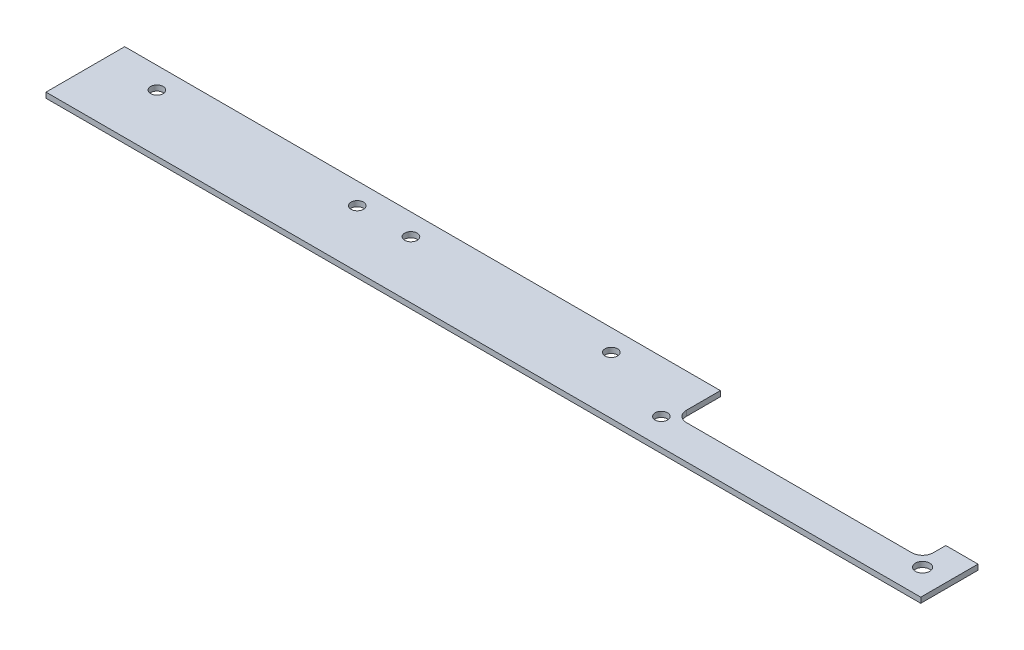
from build123d import *

# Parameters (mm, degrees)
SKETCH_1_R      = 1.75
SKETCH_1_R_2    = 2
EXTRUDE_1_DEPTH = 1.5


with BuildPart() as part:
    # Эскиз1 → Бобышка-Вытянуть1 (new body)
    with BuildSketch(Plane(origin=(0, 0, 0), x_dir=(1, 0, 0), z_dir=(0, 1, 0))):
        with BuildLine():
            Line((166.5, 22), (166.5, 12.5))
            ThreePointArc((166.5, 12.5), (167.378679656, 10.378679656), (169.5, 9.5))
            Line((169.5, 9.5), (232.5, 9.5))
            ThreePointArc((232.5, 9.5), (234.621320344, 10.378679656), (235.5, 12.5))
            Line((235.5, 12.5), (235.5, 16))
            Line((235.5, 16), (244.5, 16))
            Line((244.5, 16), (244.5, 0))
            Line((244.5, 0), (0, 0))
            Line((0, 0), (0, 22))
            Line((0, 22), (166.5, 22))
        make_face()
        with Locations((164.5, 7.5)):
            Circle(SKETCH_1_R, mode=Mode.SUBTRACT)
        with Locations((71, 16)):
            Circle(SKETCH_1_R, mode=Mode.SUBTRACT)
        with Locations((15, 16)):
            Circle(SKETCH_1_R, mode=Mode.SUBTRACT)
        with Locations((86, 16)):
            Circle(SKETCH_1_R, mode=Mode.SUBTRACT)
        with Locations((142, 16)):
            Circle(SKETCH_1_R, mode=Mode.SUBTRACT)
        with Locations((237.5, 7.5)):
            Circle(SKETCH_1_R_2, mode=Mode.SUBTRACT)
    extrude(amount=EXTRUDE_1_DEPTH)


solid = part.part
